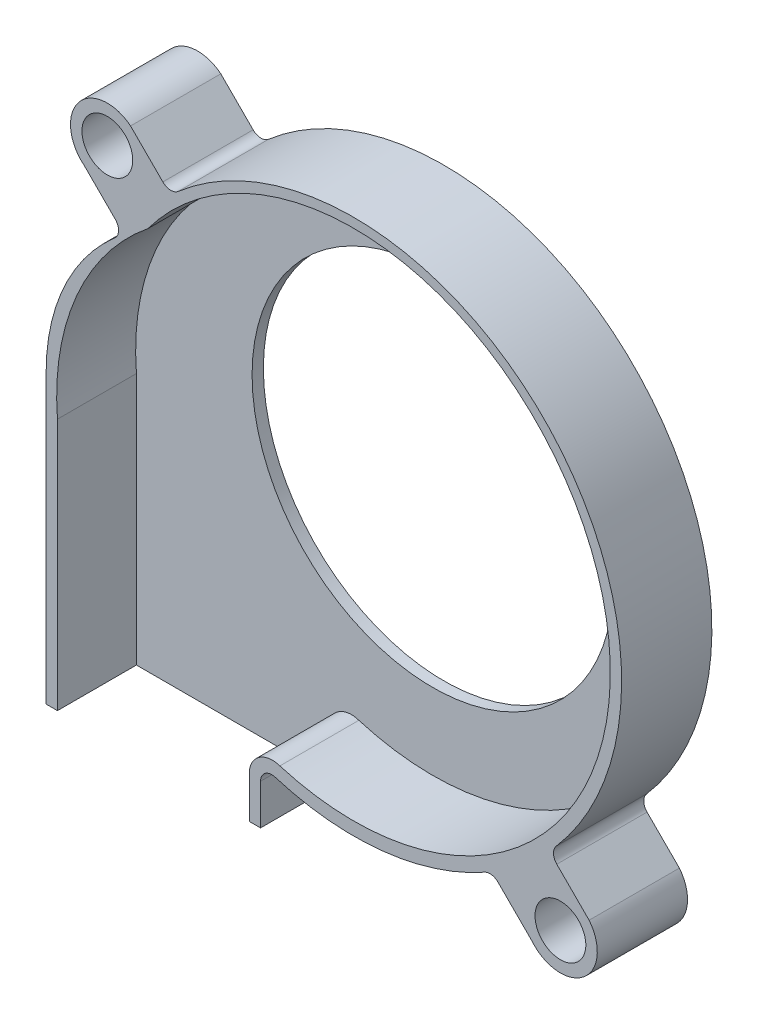
from build123d import *

# Parameters (mm, degrees)
BOSS_EXTRUDE1_DEPTH   = 8
FILLET1_R             = 1
FILLET2_R             = 1
FILLET3_R             = 1
CUT_EXTRUDE1_DEPTH    = 7
SKETCH3_R             = 16
CUT_EXTRUDE2_DEPTH    = 7
F_4_0MM_DOWEL_HOLE1_D = 4.5


with BuildPart() as part:
    # Sketch1 → Boss-Extrude1 (new body)
    with BuildSketch(Plane.XY):
        with BuildLine():
            Line((11.013257462, 44.582936616), (7.477723556, 48.118470522))
            ThreePointArc((7.477723556, 48.118470522), (2.881529478, 47.63222476), (3.36777524, 43.036030683))
            Line((3.36777524, 43.036030683), (6.903309146, 39.500496777))
            ThreePointArc((6.903309146, 39.500496777), (6.899494188, 39.494158329), (6.895681204, 39.487818693))
            ThreePointArc((6.895681204, 39.487818693), (1.817587447, 33.297587625), (0, 25.5))
            Line((0, 25.5), (0, 0))
            Line((0, 0), (19, 0))
            Line((19, 0), (19, 4.978942549))
            ThreePointArc((19, 4.978942549), (29.469637429, 3.603949385), (39.500496777, 6.903309146))
            Line((39.500496777, 6.903309146), (43.036030683, 3.36777524))
            ThreePointArc((43.036030683, 3.36777524), (47.63222476, 2.881529478), (48.118470522, 7.477723556))
            Line((48.118470522, 7.477723556), (44.582936616, 11.013257462))
            ThreePointArc((44.582936616, 11.013257462), (44.043786053, 44.043786053), (11.013257462, 44.582936616))
        make_face()
    extrude(amount=BOSS_EXTRUDE1_DEPTH)

    # Fillet1
    # the kernel refuses this fillet: 1 mm, written as the material it adds along each edge
    with BuildSketch(Plane(origin=(6.895681204, 39.487818693, 0), x_dir=(-0.6978515576075072, 0.7162424195373911, 0), z_dir=(0, 0, 1))) as fillet1_piece_1:
        with BuildLine():
            CenterArc((1.091132345, 0.99991544), FILLET1_R, 176.70951396, 94.03559873)
            Line((0.092780983, 1.057313692), (-0.007054153, 1.063053517))
            ThreePointArc((-0.007054153, 1.063053517), (-0.04527045, 0.536700242), (-0.099309015, 0.011735396))
            Line((-0.099309015, 0.011735396), (-0.096713844, -0.025425035))
            ThreePointArc((-0.096713844, -0.025425035), (0.005057841, -0.114302419), (1.105437078, -0.099991544))
            Line((1.105437078, -0.099991544), (1.104136648, 0))
        make_face()
    extrude(amount=8)
    with BuildSketch(Plane(origin=(6.903309146, 39.500496777, 0), x_dir=(-0.7071067811865462, 0.7071067811865487, 0), z_dir=(0, 0, 1))) as fillet1_piece_2:
        with BuildLine():
            CenterArc((1.100472293, 1), FILLET1_R, 175.96440127, 94.03559873)
            Line((0.102951776, 1.070376262), (0.003199724, 1.077413888))
            ThreePointArc((0.003199724, 1.077413888), (-0.102718997, 0.027384376), (-0.097051337, -0.024104732))
            Line((-0.097051337, -0.024104732), (0, -0.1))
            Line((0, -0.1), (1.100472293, -0.1))
            Line((1.100472293, -0.1), (1.100472293, 0))
        make_face()
    extrude(amount=8)

    # Fillet2
    fillet2_edges = [part.edges().sort_by_distance(p)[0] for p in [
        (11.013257462, 44.582936616, 4),
        (44.582936616, 11.013257462, 4),
        (39.500496777, 6.903309146, 4),
    ]]
    fillet(fillet2_edges, radius=FILLET2_R)

    # Fillet3
    fillet3_edges = [part.edges().sort_by_distance(p)[0] for p in [
        (19, 4.978942549, 4),
    ]]
    fillet(fillet3_edges, radius=FILLET3_R)

    # Sketch2 → Cut-Extrude1 (cut)
    with BuildSketch(Plane.XY.offset(8)):
        with BuildLine():
            Line((1, 0), (1, 22.374195455))
            ThreePointArc((1, 22.374195455), (2.695924616, 32.679401027), (9.007717621, 41.000139649))
            ThreePointArc((9.007717621, 41.000139649), (48.848807822, 34.55190705), (20.71331744, 5.616006286))
            ThreePointArc((20.71331744, 5.616006286), (18.805851762, 5.30344249), (18, 3.546534873))
            Line((18, 3.546534873), (18, 0))
            Line((18, 0), (1, 0))
        make_face()
    extrude(amount=-CUT_EXTRUDE1_DEPTH, mode=Mode.SUBTRACT)

    # Sketch3 → Cut-Extrude2 (cut)
    with BuildSketch(Plane.XY.offset(1)):
        with Locations((27.25, 27.406698819)):
            Circle(SKETCH3_R)
    extrude(amount=-CUT_EXTRUDE2_DEPTH, mode=Mode.SUBTRACT)

    # Ø4.0mm Dowel Hole1 (through all)
    with Locations(Plane(origin=(0, 0, 0), x_dir=(-1, 0, 0), z_dir=(0, 0, -1))):
        with Locations((-45.577250602, 5.422749398), (-5.422749398, 45.577250602)):
            Hole(F_4_0MM_DOWEL_HOLE1_D / 2)


solid = part.part
